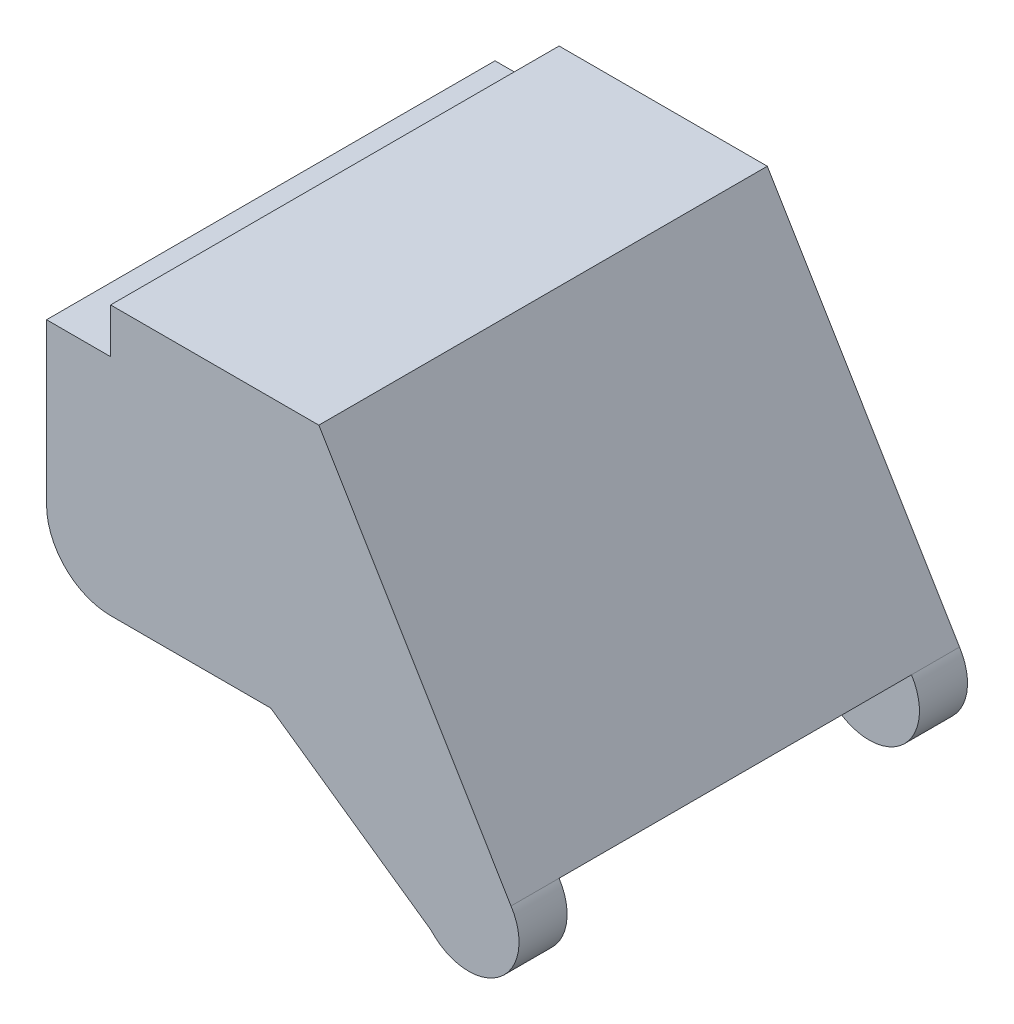
from build123d import *

# Parameters (mm, degrees)
ESTRUSIONE_ESTRUSIONE1_DEPTH = 14
SVUOTA2_START                = 1.5
SVUOTA2_DEPTH                = 11


# Read off the part's stored shape, not the designer's step: Svuota2
with BuildPart() as part:
    # Schizzo1 → Estrusione-Estrusione1 (new body)
    with BuildSketch(Plane.XY):
        with BuildLine():
            Line((0, 7), (0, 2))
            ThreePointArc((0, 2), (0.585786438, 0.585786438), (2, 0))
            Line((2, 0), (7, 0))
            Line((7, 0), (12, -3.5))
            ThreePointArc((12, -3.5), (14.128037504, -3.705312505), (14.5, -1.6))
            Line((14.5, -1.6), (8.5, 8.4))
            Line((8.5, 8.4), (2, 8.4))
            Line((2, 8.4), (2, 7))
            Line((2, 7), (0, 7))
        make_face()
    extrude(amount=ESTRUSIONE_ESTRUSIONE1_DEPTH)

    # Svuota2 outline → Svuota2 (cut)
    with BuildSketch(Plane.XY.offset(SVUOTA2_START)):
        with BuildLine():
            Line((3.5, 5.5), (0, 5.5))
            Line((0, 5.5), (0, 2))
            ThreePointArc((0, 2), (0.585786438, 0.585786438), (2, 0))
            Line((2, 0), (7, 0))
            Line((7, 0), (12, -3.5))
            ThreePointArc((12, -3.5), (14.128037504, -3.705312505), (14.5, -1.6))
            ThreePointArc((14.5, -1.6), (13.569534227, -0.926722507), (12.429297297, -1.064304775))
            Line((12.429297297, -1.064304775), (7.650714432, 6.9))
            Line((7.650714432, 6.9), (3.5, 6.9))
            Line((3.5, 6.9), (3.5, 5.5))
        make_face()
    extrude(amount=SVUOTA2_DEPTH, mode=Mode.SUBTRACT)


solid = part.part
